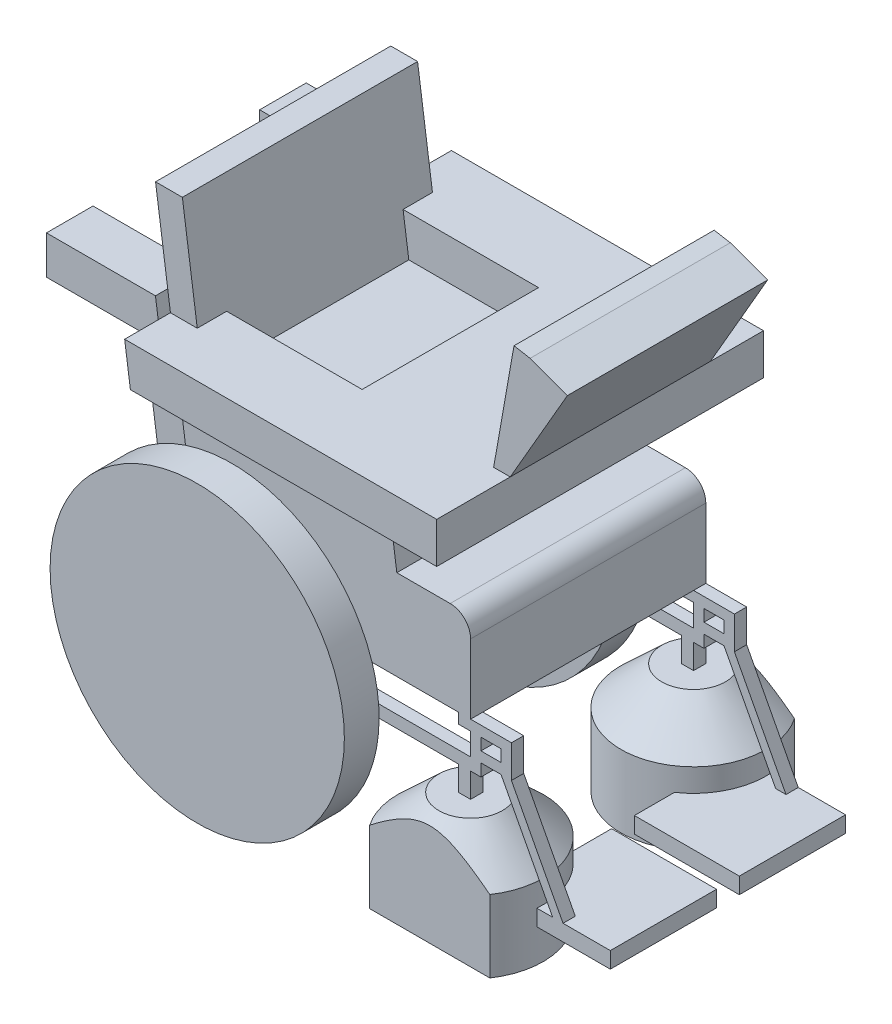
from build123d import *

# Parameters (mm, degrees)
BOSS_EXTRUDE1_DEPTH       = 30
BOSS_EXTRUDE1_DEPTH_BACK  = 55
SKETCH1_R                 = 360.2
BOSS_EXTRUDE2_DEPTH       = 55
BOSS_EXTRUDE2_DEPTH_BACK  = 30
SKETCH2_R                 = 360.2
BOSS_EXTRUDE3_DEPTH       = 10
BOSS_EXTRUDE6_DEPTH       = 575.8
BOSS_EXTRUDE33_DEPTH      = 400
BOSS_EXTRUDE33_DEPTH_BACK = 400
SKETCH25_W                = 366.7
SKETCH25_H                = 100
SKETCH5_W                 = 450
SKETCH5_H                 = 72
BOSS_EXTRUDE7_DEPTH       = 367.981167426
SKETCH8_W                 = 49.2
SKETCH8_H                 = 29.2
BOSS_EXTRUDE13_DEPTH      = 30
SKETCH19_R                = 177.8
BOSS_EXTRUDE22_DEPTH      = 270.2
CHAMFER1_SIZE             = 100
CHAMFER1_SIZE2            = 93.251508614
BOSS_EXTRUDE27_DEPTH      = 30
BOSS_EXTRUDE20_DEPTH      = 260
BOSS_EXTRUDE28_START      = 30
SKETCH23_W                = 30
SKETCH23_H                = 60
SKETCH23_W_2              = 49.2
SKETCH23_H_2              = 25.4
SKETCH23_W_3              = 25.4
BOSS_EXTRUDE28_DEPTH      = 30
SKETCH24_R                = 177.8
BOSS_EXTRUDE29_DEPTH      = 270.2
CHAMFER2_SIZE             = 100
CHAMFER2_SIZE2            = 93.251508614
BOSS_EXTRUDE30_DEPTH      = 30
BOSS_EXTRUDE31_DEPTH      = 260
BOSS_EXTRUDE18_START      = -83.975
BOSS_EXTRUDE18_DEPTH      = 113.975
BOSS_EXTRUDE19_START      = -30
BOSS_EXTRUDE19_DEPTH      = 113.975
BOSS_EXTRUDE32_START      = -575.8
BOSS_EXTRUDE32_DEPTH      = 575.8
BOSS_EXTRUDE34_REACH      = 1588.441
SKETCH26_W                = 184.1
SKETCH26_H                = 100
SKETCH27_W                = 350
SKETCH27_H                = 400
BOSS_EXTRUDE35_DEPTH      = 200
BOSS_EXTRUDE36_START      = -130
BOSS_EXTRUDE36_DEPTH      = 490
FILLET3_R                 = 50
SKETCH30_W                = 2623.123535912
SKETCH30_H                = 2420.43733062
CUT_EXTRUDE1_DEPTH        = 1934.451296391
SKETCH31_W                = 2584.765961417
SKETCH31_H                = 1858.147621016
CUT_EXTRUDE2_DEPTH        = 1913.404602985


# Read off the part's stored shape, not the designer's step: Boss-Extrude18, Boss-Extrude19, Boss-Extrude32
with BuildPart() as part:
    # Sketch1 → Boss-Extrude1 (new, two sides: drawn at the far end of the back side and taken through both)
    with BuildSketch(Plane.XY.offset(-BOSS_EXTRUDE1_DEPTH_BACK)):
        with Locations((330.2, 330.2)):
            Circle(SKETCH1_R)
    extrude(amount=BOSS_EXTRUDE1_DEPTH + BOSS_EXTRUDE1_DEPTH_BACK)



with BuildPart() as body_2:
    # Sketch2 → Boss-Extrude2 (new, two sides: drawn at the far end of the back side and taken through both)
    with BuildSketch(Plane.XY.offset(-685.8).offset(-BOSS_EXTRUDE2_DEPTH_BACK)):
        with Locations((330.2, 330.2)):
            Circle(SKETCH2_R)
    extrude(amount=BOSS_EXTRUDE2_DEPTH + BOSS_EXTRUDE2_DEPTH_BACK)


with BuildPart() as part_1:
    add(part.part)

    add(body_2.part)  # Boss-Extrude3 merges body 2
    # 3DSketch2 → Boss-Extrude3 (add)
    with BuildSketch(Plane(origin=(330.2, 460, -630.8), x_dir=(0.5893057409504111, 0, 0.807910108664873), z_dir=(0, -1, 0))):
        Polygon((465.194640569, 339.322245639), (0, 0), (247.508411199, -339.322245639), (712.703051768, 0), align=None)
        Polygon((-38.304873162, 52.514157063), (0, 0), (465.194640569, 339.322245639), (426.889767407, 391.836402702), align=None)
    extrude(amount=-BOSS_EXTRUDE3_DEPTH)

    # Sketch4 → Boss-Extrude6 (add)
    with BuildSketch(Plane(origin=(0, -170.8, -630.8), x_dir=(1, 0, 0), z_dir=(0, 0, 1))):
        Polygon((208.828935151, 1364.6), (330.2, 501), (265.832575532, 491.953748438), (143.190142937, 1364.6), align=None)
    extrude(amount=BOSS_EXTRUDE6_DEPTH)

    # Sketch5 → Boss-Extrude7 (add, along a direction that is not the sketch's normal)
    with BuildSketch(Plane(origin=(0, 470, 0), x_dir=(1, 0, 0), z_dir=(0, 1, 0))):
        with Locations((535.552391309, 91)):
            Rectangle(SKETCH5_W, SKETCH5_H)
        with Locations((535.552391309, 594.8)):
            Rectangle(SKETCH5_W, SKETCH5_H)
    extrude(amount=BOSS_EXTRUDE7_DEPTH, dir=(-0.13917310096006222, 0.9902680687415708, 0))

    # Sketch8 → Boss-Extrude13 (add)
    with BuildSketch(Plane(origin=(0, 0, -630.8), x_dir=(-1, 0, 0), z_dir=(0, 0, -1))):
        Polygon((-1014.4, 360.2), (-939.8, 360.2), (-939.8, 330.2), (-914.4, 330.2), (-914.4, 270.2), (-884.4, 270.2), (-884.4, 330.2), (-330.2, 330.2), (-325.983774959, 360.2), (-914.4, 360.2), (-914.4, 414.8), (-884.4, 414.8), (-884.4, 440.2), (-1014.4, 440.2), align=None)
        with Locations((-964.4, 400.2)):
            Rectangle(SKETCH8_W, SKETCH8_H, mode=Mode.SUBTRACT)
    extrude(amount=-BOSS_EXTRUDE13_DEPTH)

    # Sketch19 → Boss-Extrude22 (add)
    with BuildSketch(Plane.XZ.offset(-270.2)):
        with Locations(Location((899.4, -615.8, 0), (0, 0, 90))):
            Circle(SKETCH19_R)
    extrude(amount=BOSS_EXTRUDE22_DEPTH)

    # Chamfer1
    chamfer1_edges = [part_1.edges().sort_by_distance(p)[0] for p in [
        (899.4, 270.2, -793.6),
    ]]
    chamfer1_side = [part_1.faces().sort_by_distance(p)[0] for p in [
        (899.4, 270.2, -788.571056572),
    ]]
    chamfer(chamfer1_edges, length=CHAMFER1_SIZE, length2=CHAMFER1_SIZE2, reference=chamfer1_side[0])

    # Sketch8<7> → Boss-Extrude27 (add)
    with BuildSketch(Plane(origin=(0, 0, -630.8), x_dir=(-1, 0, 0), z_dir=(0, 0, -1))):
        Polygon((-1014.4, 360.2), (-1140.7, 120.65), (-1115.3, 120.65), (-989, 360.2), align=None)
    extrude(amount=-BOSS_EXTRUDE27_DEPTH)

    # Sketch8<4> → Boss-Extrude20 (add)
    with BuildSketch(Plane(origin=(0, 0, -630.8), x_dir=(-1, 0, 0), z_dir=(0, 0, -1))):
        Polygon((-1256.425, 81.125), (-1256.425, 120.65), (-1140.7, 120.65), (-1115.3, 120.65), (-999.575, 120.65), (-999.575, 81.125), align=None)
    extrude(amount=-BOSS_EXTRUDE20_DEPTH)

    # Sketch23 → Boss-Extrude28 (add)
    with BuildSketch(Plane(origin=(0, 0, -55), x_dir=(-1, 0, 0), z_dir=(0, 0, -1)).offset(BOSS_EXTRUDE28_START)):
        with BuildLine():
            Line((-330.2, 360.2), (-689.148519986, 360.2))
            ThreePointArc((-689.148519986, 360.2), (-690.086993999, 345.213046012), (-690.4, 330.2))
            Line((-690.4, 330.2), (-330.2, 330.2))
            Line((-330.2, 330.2), (-330.2, 360.2))
        make_face()
        with BuildLine():
            Line((-914.4, 360.2), (-939.8, 360.2))
            Line((-939.8, 360.2), (-939.8, 330.2))
            Line((-939.8, 330.2), (-914.4, 330.2))
            Line((-914.4, 330.2), (-884.4, 330.2))
            Line((-884.4, 330.2), (-690.4, 330.2))
            ThreePointArc((-690.4, 330.2), (-690.086993999, 345.213046012), (-689.148519986, 360.2))
            Line((-689.148519986, 360.2), (-914.4, 360.2))
        make_face()
        with Locations((-899.4, 300.2)):
            Rectangle(SKETCH23_W, SKETCH23_H)
        Polygon((-939.8, 385.6), (-939.8, 360.2), (-914.4, 360.2), (-914.4, 414.8), (-914.4, 440.2), (-939.8, 440.2), (-939.8, 414.8), align=None)
        with Locations((-964.4, 372.9)):
            Rectangle(SKETCH23_W_2, SKETCH23_H_2)
        with Locations((-964.4, 427.5)):
            Rectangle(SKETCH23_W_2, SKETCH23_H_2)
        Polygon((-1014.4, 440.2), (-1014.4, 385.6), (-989, 385.6), (-989, 414.8), (-989, 440.2), align=None)
        with Locations((-1001.7, 372.9)):
            Rectangle(SKETCH23_W_3, SKETCH23_H_2)
        Polygon((-325.983774959, 360.2), (-330.2, 360.2), (-330.2, 330.2), align=None)
        with Locations((-899.4, 427.5)):
            Rectangle(SKETCH23_W, SKETCH23_H_2)
    extrude(amount=-BOSS_EXTRUDE28_DEPTH)

    # Sketch24 → Boss-Extrude29 (add)
    with BuildSketch(Plane(origin=(0, 270.2, 0), x_dir=(-1, 0, 0), z_dir=(0, -1, 0))):
        with Locations(Location((-899.4, 70, 0), (0, 0, 270))):
            Circle(SKETCH24_R)
    extrude(amount=BOSS_EXTRUDE29_DEPTH)

    # Chamfer2
    chamfer2_edges = [part_1.edges().sort_by_distance(p)[0] for p in [
        (899.4, 270.2, -247.8),
    ]]
    chamfer2_side = [part_1.faces().sort_by_distance(p)[0] for p in [
        (899.4, 270.2, -242.771056572),
    ]]
    chamfer(chamfer2_edges, length=CHAMFER2_SIZE, length2=CHAMFER2_SIZE2, reference=chamfer2_side[0])

    # Sketch23<10> → Boss-Extrude30 (add)
    with BuildSketch(Plane(origin=(0, 0, -55), x_dir=(-1, 0, 0), z_dir=(0, 0, -1))):
        Polygon((-1014.4, 360.2), (-1140.7, 120.65), (-1115.3, 120.65), (-989, 360.2), align=None)
    extrude(amount=BOSS_EXTRUDE30_DEPTH)

    # Sketch23<12> → Boss-Extrude31 (add)
    with BuildSketch(Plane(origin=(0, 0, -55), x_dir=(-1, 0, 0), z_dir=(0, 0, -1))):
        Polygon((-1256.425, 81.125), (-1256.425, 120.65), (-1140.7, 120.65), (-1115.3, 120.65), (-999.575, 120.65), (-999.575, 81.125), align=None)
    extrude(amount=BOSS_EXTRUDE31_DEPTH)

    # Boss-Extrude18 outline → Boss-Extrude18 (add)
    with BuildSketch(Plane(origin=(0, 0, -630.8), x_dir=(-1, 0, 0), z_dir=(0, 0, -1)).offset(BOSS_EXTRUDE18_START)):
        Polygon((93.839496852, 982.025), (-172.953178206, 982.025), (-186.160503148, 888.05), (93.839496852, 888.05), align=None)
    extrude(amount=BOSS_EXTRUDE18_DEPTH)

    # Boss-Extrude19 outline → Boss-Extrude19 (add)
    with BuildSketch(Plane(origin=(0, 0, -55), x_dir=(-1, 0, 0), z_dir=(0, 0, -1)).offset(BOSS_EXTRUDE19_START)):
        Polygon((93.839496852, 982.025), (-172.953178206, 982.025), (-186.160503148, 888.05), (93.839496852, 888.05), align=None)
    extrude(amount=BOSS_EXTRUDE19_DEPTH)

    # Boss-Extrude32 outline → Boss-Extrude32 (add)
    with BuildSketch(Plane(origin=(0, 0, -630.8), x_dir=(-1, 0, 0), z_dir=(0, 0, -1)).offset(BOSS_EXTRUDE32_START)):
        with BuildLine():
            Line((-750.2, 460), (-750.2, 470))
            Line((-750.2, 470), (-310.552391309, 470))
            Line((-310.552391309, 470), (-283.793416382, 660.4))
            Line((-283.793416382, 660.4), (-474.11664254, 660.4))
            ThreePointArc((-474.11664254, 660.4), (-378.928501989, 687.088740497), (-280.069849034, 686.894558361))
            Line((-280.069849034, 686.894558361), (-259.339311143, 834.4))
            Line((-259.339311143, 834.4), (-709.339311143, 834.4))
            Line((-709.339311143, 834.4), (-733.793416381, 660.4))
            Line((-733.793416381, 660.4), (-914.4, 660.4))
            Line((-914.4, 660.4), (-914.4, 440.2))
            Line((-914.4, 440.2), (-314.740508183, 440.2))
            Line((-314.740508183, 440.2), (-311.957799656, 460))
            Line((-311.957799656, 460), (-750.2, 460))
        make_face()
    extrude(amount=BOSS_EXTRUDE32_DEPTH)



with BuildPart() as body_2_2:
    # Sketch25 → Boss-Extrude33 (new, two sides: drawn at the far end of the back side and taken through both)
    with BuildSketch(Plane.XY.offset(-342.9).offset(-BOSS_EXTRUDE33_DEPTH_BACK)):
        with Locations((760.189311143, 884.4)):
            Rectangle(SKETCH25_W, SKETCH25_H)
    extrude(amount=BOSS_EXTRUDE33_DEPTH + BOSS_EXTRUDE33_DEPTH_BACK)


with BuildPart() as part_2:
    add(part_1.part)

    add(body_2_2.part)  # Boss-Extrude34 merges body 2 2
    # Boss-Extrude34: up to this plane
    boss_extrude34_end = Plane(origin=(143.190142937, 1193.8, 837.459616456), z_dir=(0.9902680687415708, 0.1391731009600622, 0))
    # Sketch26 → Boss-Extrude34 (add, up to the surface)
    with BuildSketch(Plane.ZY.offset(-576.839311143), mode=Mode.PRIVATE) as boss_extrude34_sk1:
        with Locations((-34.95, 884.4)):
            Rectangle(SKETCH26_W, SKETCH26_H)
    boss_extrude34_tool1 = split(extrude(boss_extrude34_sk1.sketch, amount=BOSS_EXTRUDE34_REACH, mode=Mode.PRIVATE), bisect_by=boss_extrude34_end, keep=Keep.BOTH, mode=Mode.PRIVATE)
    add(boss_extrude34_tool1.solids().sort_by_distance((576.839311, 884.4, -34.95))[0])
    # Sketch26 → Boss-Extrude34 (add, up to the surface)
    with BuildSketch(Plane.ZY.offset(-576.839311143), mode=Mode.PRIVATE) as boss_extrude34_sk2:
        with Locations((-650.85, 884.4)):
            Rectangle(SKETCH26_W, SKETCH26_H)
    boss_extrude34_tool2 = split(extrude(boss_extrude34_sk2.sketch, amount=BOSS_EXTRUDE34_REACH, mode=Mode.PRIVATE), bisect_by=boss_extrude34_end, keep=Keep.BOTH, mode=Mode.PRIVATE)
    add(boss_extrude34_tool2.solids().sort_by_distance((576.839311, 884.4, -650.85))[0])

    # Sketch27 → Boss-Extrude35 (add)
    with BuildSketch(Plane(origin=(304.944608977, 42.857169884, 0), x_dir=(0, 0, 1), z_dir=(-0.9902680687415708, -0.13917310096006216, 0))):
        with Locations((-342.9, 481.031558361)):
            Rectangle(SKETCH27_W, SKETCH27_H)
    extrude(amount=BOSS_EXTRUDE35_DEPTH)

    # Sketch29 → Boss-Extrude36 (add)
    with BuildSketch(Plane(origin=(0, 0, -742.9), x_dir=(-1, 0, 0), z_dir=(0, 0, -1)).offset(BOSS_EXTRUDE36_START)):
        Polygon((-1083.539311143, 1176.88711306), (-992.16080089, 1210.146170843), (-943.539311143, 934.4), align=None)
        Polygon((-992.16080089, 1210.146170843), (-943.539311143, 934.4), (-902.922246668, 934.4), (-952.768490769, 1217.09209795), align=None)
    extrude(amount=-BOSS_EXTRUDE36_DEPTH)

    # Fillet3
    fillet3_edges = [part_2.edges().sort_by_distance(p)[0] for p in [
        (914.4, 660.4, -342.9),
    ]]
    fillet(fillet3_edges, radius=FILLET3_R)

    # Sketch30 → Cut-Extrude1 (cut, through all)
    with BuildSketch(Plane.XY.offset(30)):
        with Locations((451.826678709, -519.81866531)):
            Rectangle(SKETCH30_W, SKETCH30_H)
    extrude(amount=CUT_EXTRUDE1_DEPTH, mode=Mode.SUBTRACT)

    # Sketch31 → Cut-Extrude2 (cut, through all)
    with BuildSketch(Plane(origin=(0, 0, -715.8), x_dir=(-1, 0, 0), z_dir=(0, 0, -1))):
        with Locations((-741.050727566, -238.673810508)):
            Rectangle(SKETCH31_W, SKETCH31_H)
    extrude(amount=CUT_EXTRUDE2_DEPTH, mode=Mode.SUBTRACT)


solid = part_2.part
